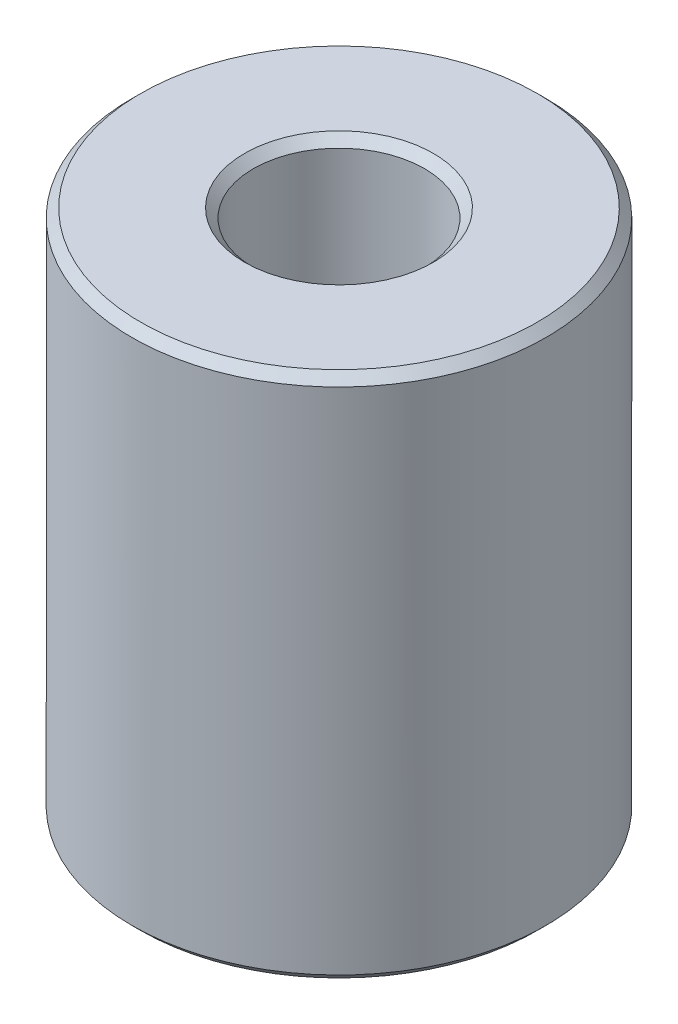
from build123d import *

# Parameters (mm, degrees)
SKETCH1_R           = 60
BOSS_EXTRUDE1_DEPTH = 152.674371253
SKETCH2_R           = 24.79885839
CUT_EXTRUDE1_DEPTH  = 175.66958418
CHAMFER1_SIZE       = 2.55552359


with BuildPart() as part:
    # Sketch1 → Boss-Extrude1 (new body)
    with BuildSketch(Plane(origin=(0, 0, 0), x_dir=(1, 0, 0), z_dir=(0, 1, 0))):
        Circle(SKETCH1_R)
    extrude(amount=BOSS_EXTRUDE1_DEPTH)

    # Sketch2 → Cut-Extrude1 (cut, through all)
    with BuildSketch(Plane(origin=(0, 0, 0), x_dir=(1, 0, 0), z_dir=(0, 1, 0))):
        Circle(SKETCH2_R)
    extrude(amount=CUT_EXTRUDE1_DEPTH, mode=Mode.SUBTRACT)

    # Chamfer1
    chamfer1_edges = [part.edges().sort_by_distance(p)[0] for p in [
        (-24.79885839, 152.674371253, 0),
        (-24.79885839, 0, 0),
        (-60, 0, 0),
        (-60, 152.674371253, 0),
    ]]
    chamfer(chamfer1_edges, length=CHAMFER1_SIZE)


solid = part.part
